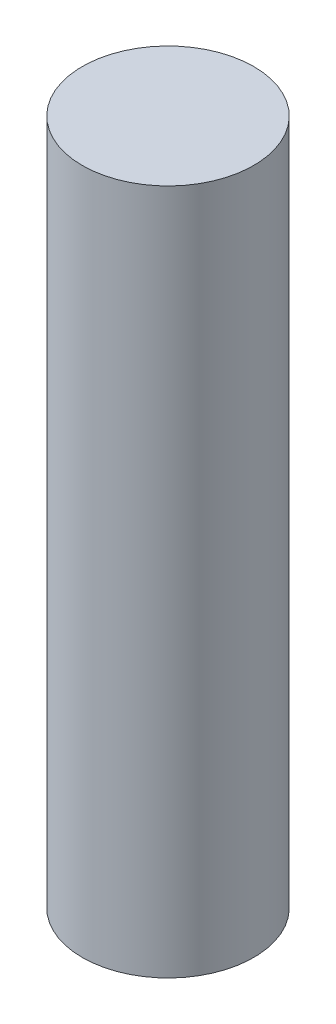
from build123d import *

# Parameters (mm, degrees)
SKETCH1_R           = 12.7
BOSS_EXTRUDE1_DEPTH = 101.6


with BuildPart() as part:
    # Sketch1 → Boss-Extrude1 (new body)
    with BuildSketch(Plane(origin=(0, 0, 0), x_dir=(1, 0, 0), z_dir=(0, 1, 0))):
        Circle(SKETCH1_R)
    extrude(amount=BOSS_EXTRUDE1_DEPTH)


solid = part.part
